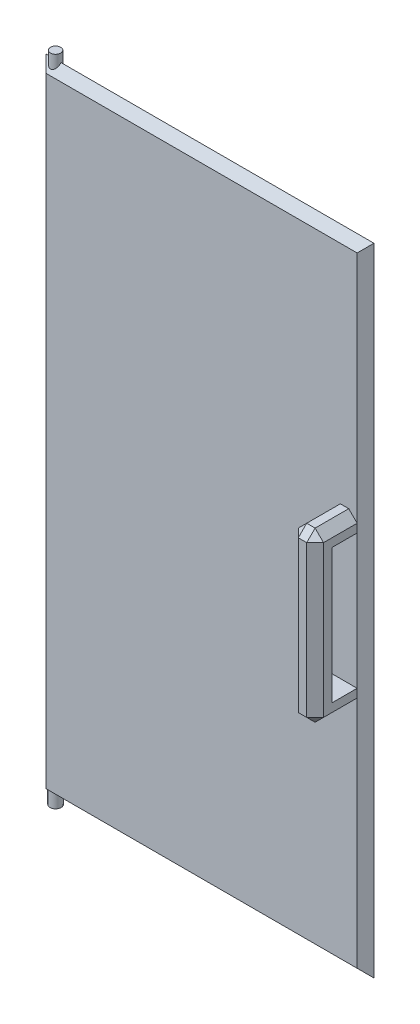
from build123d import *

# Parameters (mm, degrees)
SKETCH1_W           = 390
SKETCH1_H           = 756.8
BOSS_EXTRUDE1_DEPTH = 20
SKETCH2_R           = 6.05
BOSS_EXTRUDE2_DEPTH = 10
SKETCH3_R           = 6.631048811
BOSS_EXTRUDE3_DEPTH = 10
CHAMFER1_SIZE       = 10
BOSS_EXTRUDE5_DEPTH = 50
SKETCH5_W           = 30
SKETCH5_H           = 160
CUT_EXTRUDE1_DEPTH  = 50
CHAMFER2_SIZE       = 10


with BuildPart() as part:
    # Sketch1 → Boss-Extrude1 (new body)
    with BuildSketch(Plane.XY):
        with Locations((154.409313495, -346.327898551)):
            Rectangle(SKETCH1_W, SKETCH1_H)
    extrude(amount=BOSS_EXTRUDE1_DEPTH)

    # Sketch2 → Boss-Extrude2 (add)
    with BuildSketch(Plane(origin=(0, 32.072101449, 0), x_dir=(1, 0, 0), z_dir=(0, 1, 0))):
        with Locations(Location((-28.78378628, -10.435138004, 0), (0, 0, 90))):
            Circle(SKETCH2_R)
    extrude(amount=BOSS_EXTRUDE2_DEPTH)

    # Sketch3 → Boss-Extrude3 (add)
    with BuildSketch(Plane.XZ.offset(724.727898551)):
        with Locations(Location((-28.78378628, 10.435138004, 0), (0, 0, 90))):
            Circle(SKETCH3_R)
    extrude(amount=BOSS_EXTRUDE3_DEPTH)

    # Chamfer1
    # the kernel refuses this chamfer: 10 mm, written as the material it takes off along each edge
    with BuildSketch(Plane(origin=(-40.590686505, -750.44472843, 20), x_dir=(-0.027495876610586317, 0, -0.9996219169112968), z_dir=(0, 1, 0)), Plane(origin=(349.409313495, 57.788931329, 0), x_dir=(-0.9996219169112968, 0, -0.027495876610586334), z_dir=(0, -1, 0))) as chamfer1_piece_1:
        Polygon((CHAMFER1_SIZE * 0.999621916911, -CHAMFER1_SIZE * 0.0274958766106), (-CHAMFER1_SIZE * 0.0274958766106, -CHAMFER1_SIZE * 0.999621916911), (0, 0), align=None)
    extrude(amount=808.233659759, mode=Mode.SUBTRACT)
    with BuildSketch(Plane(origin=(375.126143374, -724.727898551, 20), x_dir=(0, 0.9996219169112968, 0.02749587661058643), z_dir=(-1, 0, 0))) as chamfer1_piece_2_section:
        Polygon((CHAMFER1_SIZE * 0.999621916911, CHAMFER1_SIZE * 0.0274958766106), (-CHAMFER1_SIZE * 0.0274958766106, CHAMFER1_SIZE * 0.999621916911), (0, 0), align=None)
    chamfer1_piece_2 = extrude(amount=441.433659759, mode=Mode.PRIVATE)
    chamfer1_piece_2 = chamfer1_piece_2 - Plane(origin=(-28.78378628, -721.415314621, 10.435138004), x_dir=(0, 0, 1), z_dir=(0, 1, 0)) * Cylinder(6.631048811, 923, mode=Mode.PRIVATE)
    add(chamfer1_piece_2, mode=Mode.SUBTRACT)
    with BuildSketch(Plane(origin=(349.409313495, 57.788931329, 20), x_dir=(-0.9996219169112968, 0, 0.027495876610586282), z_dir=(0, -1, 0)), Plane(origin=(-40.590686505, -750.44472843, 0), x_dir=(-0.027495876610586317, 0, 0.9996219169112968), z_dir=(0, 1, 0))) as chamfer1_piece_3:
        Polygon((CHAMFER1_SIZE * 0.999621916911, CHAMFER1_SIZE * 0.0274958766106), (-CHAMFER1_SIZE * 0.0274958766106, CHAMFER1_SIZE * 0.999621916911), (0, 0), align=None)
    extrude(amount=808.233659759, mode=Mode.SUBTRACT)
    with BuildSketch(Plane(origin=(-66.307516385, 32.072101449, 20), x_dir=(0, 0.027495876610586317, -0.9996219169112968), z_dir=(1, 0, 0))) as chamfer1_piece_4_section:
        Polygon((CHAMFER1_SIZE * 0.999621916911, -CHAMFER1_SIZE * 0.0274958766106), (-CHAMFER1_SIZE * 0.0274958766106, -CHAMFER1_SIZE * 0.999621916911), (0, 0), align=None)
    chamfer1_piece_4 = extrude(amount=441.433659759, mode=Mode.PRIVATE)
    chamfer1_piece_4 = chamfer1_piece_4 - Plane(origin=(-28.78378628, 28.76135635, 10.435138004), x_dir=(0, 0, -1), z_dir=(0, -1, 0)) * Cylinder(6.05, 923, mode=Mode.PRIVATE)
    add(chamfer1_piece_4, mode=Mode.SUBTRACT)
    with BuildSketch(Plane(origin=(375.126143374, -724.727898551, 0), x_dir=(0, 0.9996219169112968, -0.027495876610586487), z_dir=(-1, 0, 0))) as chamfer1_piece_5_section:
        Polygon((CHAMFER1_SIZE * 0.999621916911, -CHAMFER1_SIZE * 0.0274958766106), (-CHAMFER1_SIZE * 0.0274958766106, -CHAMFER1_SIZE * 0.999621916911), (0, 0), align=None)
    chamfer1_piece_5 = extrude(amount=441.433659759, mode=Mode.PRIVATE)
    chamfer1_piece_5 = chamfer1_piece_5 - Plane(origin=(-28.78378628, -721.416873801, 10.435138004), x_dir=(0, 0, 1), z_dir=(0, 1, 0)) * Cylinder(6.631048811, 923, mode=Mode.PRIVATE)
    add(chamfer1_piece_5, mode=Mode.SUBTRACT)
    with BuildSketch(Plane(origin=(-66.307516385, 32.072101449, 0), x_dir=(0, 0.027495876610586317, 0.9996219169112968), z_dir=(1, 0, 0))) as chamfer1_piece_6_section:
        Polygon((CHAMFER1_SIZE * 0.999621916911, CHAMFER1_SIZE * 0.0274958766106), (-CHAMFER1_SIZE * 0.0274958766106, CHAMFER1_SIZE * 0.999621916911), (0, 0), align=None)
    chamfer1_piece_6 = extrude(amount=441.433659759, mode=Mode.PRIVATE)
    chamfer1_piece_6 = chamfer1_piece_6 - Plane(origin=(-28.78378628, 28.763199232, 10.435138004), x_dir=(0, 0, -1), z_dir=(0, -1, 0)) * Cylinder(6.05, 923, mode=Mode.PRIVATE)
    add(chamfer1_piece_6, mode=Mode.SUBTRACT)

    # Sketch4 → Boss-Extrude5 (add)
    with BuildSketch(Plane.XY.offset(20)):
        Polygon((309.409313495, -346.327898551), (309.409313495, -246.327898551), (339.409313495, -246.327898551), (339.409313495, -446.327898551), (309.409313495, -446.327898551), align=None)
    extrude(amount=BOSS_EXTRUDE5_DEPTH)

    # Sketch5 → Cut-Extrude1 (cut)
    with BuildSketch(Plane(origin=(339.409313495, 0, 0), x_dir=(0, 0, -1), z_dir=(1, 0, 0))):
        with Locations((-35, -346.327898551)):
            Rectangle(SKETCH5_W, SKETCH5_H)
    extrude(amount=-CUT_EXTRUDE1_DEPTH, mode=Mode.SUBTRACT)

    # Chamfer2
    chamfer2_edges = [part.edges().sort_by_distance(p)[0] for p in [
        (309.409313495, -346.327898551, 70),
        (309.409313495, -246.327898551, 45),
        (324.409313495, -446.327898551, 70),
        (309.409313495, -446.327898551, 45),
        (339.409313495, -446.327898551, 45),
        (324.409313495, -246.327898551, 70),
        (339.409313495, -246.327898551, 45),
        (339.409313495, -346.327898551, 70),
    ]]
    chamfer(chamfer2_edges, length=CHAMFER2_SIZE)


solid = part.part
